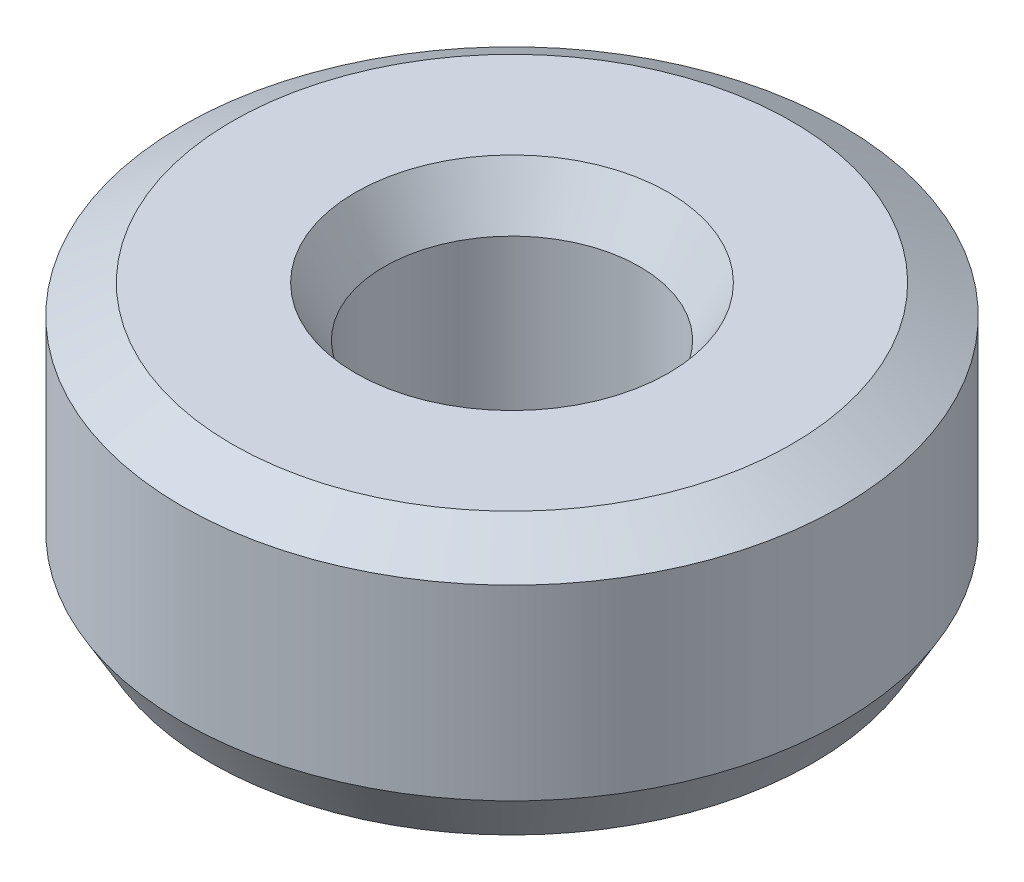
from build123d import *
from OCP.BRepFilletAPI import BRepFilletAPI_MakeChamfer

# Parameters (mm, degrees)
SKETCH1_R           = 12.5
BOSS_EXTRUDE1_DEPTH = 10.06710981
SKETCH2_R           = 4.843373265
CUT_EXTRUDE1_DEPTH  = 21.343222457
CHAMFER1_SIZE       = 1.092546854
CHAMFER1_SIZE2      = 1.89234666


with BuildPart() as part:
    # Sketch1 → Boss-Extrude1 (new body)
    with BuildSketch(Plane(origin=(0, 0, 0), x_dir=(1, 0, 0), z_dir=(0, 1, 0))):
        Circle(SKETCH1_R)
    extrude(amount=BOSS_EXTRUDE1_DEPTH)

    # Sketch2 → Cut-Extrude1 (cut, through all)
    with BuildSketch(Plane(origin=(0, 0, 0), x_dir=(1, 0, 0), z_dir=(0, 1, 0))):
        Circle(SKETCH2_R)
    extrude(amount=CUT_EXTRUDE1_DEPTH, mode=Mode.SUBTRACT)

    # Chamfer1: one chamfer whose edges measure the first distance from different faces: ONE call of the kernel's chamfer builder (chamfer() names one face for all edges)
    chamfer1_edges_1 = [part.edges().sort_by_distance(p)[0] for p in [
        (-4.843373265, 10.06710981, 0),
    ]]
    chamfer1_side_1 = [part.faces().sort_by_distance(p)[0] for p in [
        (-12.146446609, 10.06710981, 0),
    ]]
    chamfer1_edges_2 = [part.edges().sort_by_distance(p)[0] for p in [
        (-4.843373265, 0, 0),
    ]]
    chamfer1_side_2 = [part.faces().sort_by_distance(p)[0] for p in [
        (-4.843373265, 5.033554905, 0),
    ]]
    chamfer1_edges_3 = [part.edges().sort_by_distance(p)[0] for p in [
        (-12.5, 0, 0),
    ]]
    chamfer1_side_3 = [part.faces().sort_by_distance(p)[0] for p in [
        (-12.146446609, 0, 0),
    ]]
    chamfer1_edges_4 = [part.edges().sort_by_distance(p)[0] for p in [
        (-12.5, 10.06710981, 0),
    ]]
    chamfer1_side_4 = [part.faces().sort_by_distance(p)[0] for p in [
        (-12.5, 5.033554905, 0),
    ]]
    chamfer1 = BRepFilletAPI_MakeChamfer(part.part.solid().wrapped)
    for e in chamfer1_edges_1:
        chamfer1.Add(CHAMFER1_SIZE, CHAMFER1_SIZE2, e.wrapped, chamfer1_side_1[0].wrapped)  # the first distance lies on this face
    for e in chamfer1_edges_2:
        chamfer1.Add(CHAMFER1_SIZE, CHAMFER1_SIZE2, e.wrapped, chamfer1_side_2[0].wrapped)  # the first distance lies on this face
    for e in chamfer1_edges_3:
        chamfer1.Add(CHAMFER1_SIZE, CHAMFER1_SIZE2, e.wrapped, chamfer1_side_3[0].wrapped)  # the first distance lies on this face
    for e in chamfer1_edges_4:
        chamfer1.Add(CHAMFER1_SIZE, CHAMFER1_SIZE2, e.wrapped, chamfer1_side_4[0].wrapped)  # the first distance lies on this face
    add(Compound.cast(chamfer1.Shape()), mode=Mode.REPLACE)


solid = part.part
